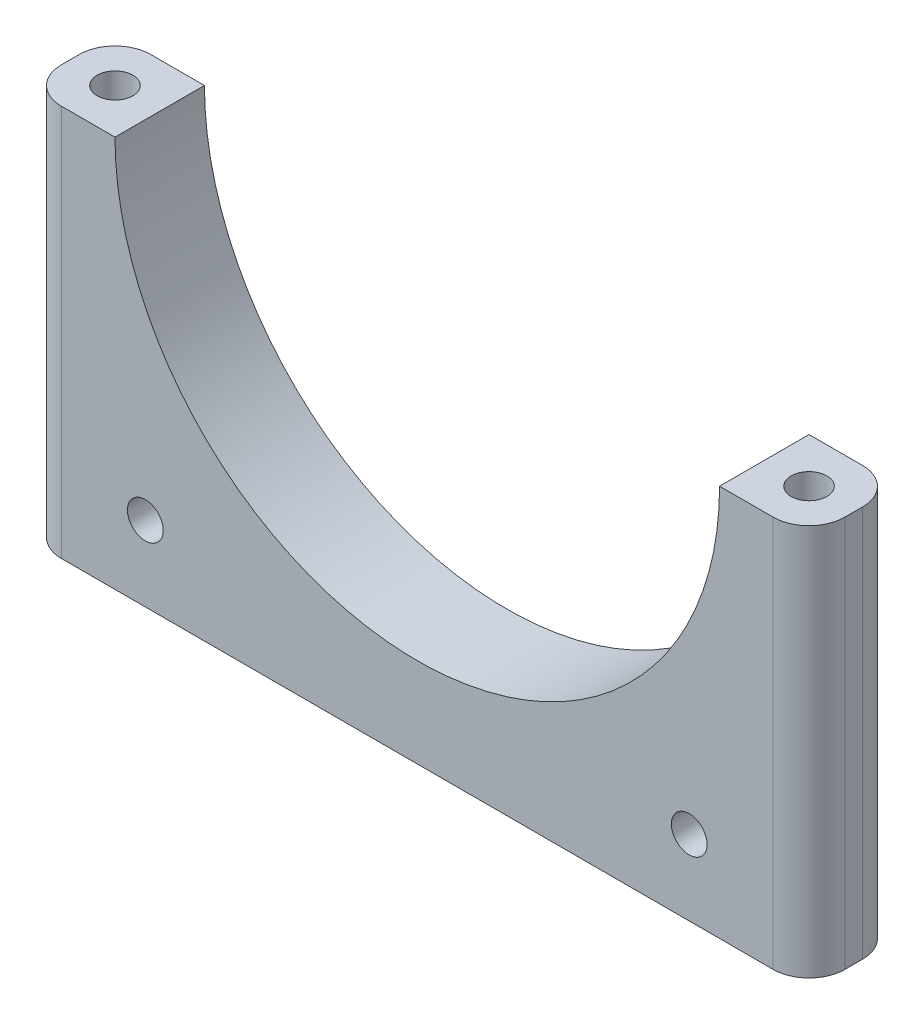
from build123d import *

# Parameters (mm, degrees)
BOSS_EXTRUDE1_DEPTH = 25
SKETCH5_R           = 5
CUT_EXTRUDE1_DEPTH  = 5000
SKETCH6_R           = 5
CUT_EXTRUDE2_DEPTH  = 5000
FILLET2_R           = 10


with BuildPart() as part:
    # Sketch4 → Boss-Extrude1 (new body)
    with BuildSketch(Plane.XY):
        with BuildLine():
            ThreePointArc((84.5, 84.5), (0, 0), (-84.5, 84.5))
            Line((-84.5, 84.5), (-109.5, 84.5))
            Line((-109.5, 84.5), (-109.5, -25))
            Line((-109.5, -25), (109.5, -25))
            Line((109.5, -25), (109.5, 84.5))
            Line((109.5, 84.5), (84.5, 84.5))
        make_face()
    extrude(amount=BOSS_EXTRUDE1_DEPTH)

    # Sketch5 → Cut-Extrude1 (cut)
    with BuildSketch(Plane(origin=(0, 84.5, 0), x_dir=(1, 0, 0), z_dir=(0, 1, 0))):
        with Locations((-97, -12.5)):
            Circle(SKETCH5_R)
        with Locations((97, -12.5)):
            Circle(SKETCH5_R)
    extrude(amount=-CUT_EXTRUDE1_DEPTH, mode=Mode.SUBTRACT)

    # Sketch6 → Cut-Extrude2 (cut)
    with BuildSketch(Plane.XY.offset(25)):
        with Locations((-76.015, -4)):
            Circle(SKETCH6_R)
        with Locations((76.015, -4)):
            Circle(SKETCH6_R)
    extrude(amount=-CUT_EXTRUDE2_DEPTH, mode=Mode.SUBTRACT)

    # Fillet2
    fillet2_edges = [part.edges().sort_by_distance(p)[0] for p in [
        (109.5, 29.75, 25),
        (109.5, 29.75, 0),
        (-109.5, 29.75, 25),
        (-109.5, 29.75, 0),
    ]]
    fillet(fillet2_edges, radius=FILLET2_R)


solid = part.part
